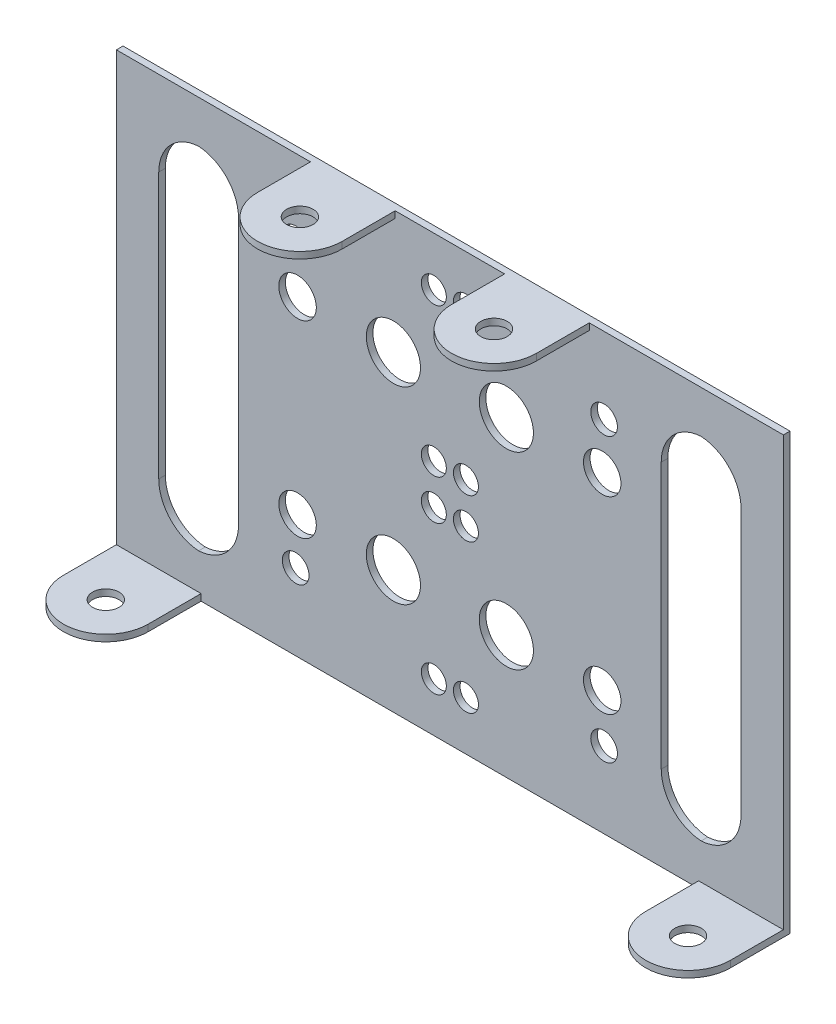
from build123d import *

# Parameters (mm, degrees)
SKETCH1_R             = 1.5875
BOSS_EXTRUDE1_DEPTH   = 1.5875
SKETCH1_W             = 12.7
SKETCH1_H             = 12.7
BOSS_EXTRUDE1_2_DEPTH = 1.5875
SKETCH2_W             = 69.85
SKETCH2_H             = 53
BOSS_EXTRUDE2_DEPTH   = 1.5875
BOSS_EXTRUDE3_DEPTH   = 1.5875
SKETCH6_W             = 1.5875
SKETCH6_H             = 53
BOSS_EXTRUDE4_DEPTH   = 12.7
SKETCH7_W             = 12.7
SKETCH7_H             = 12.7
CUT_EXTRUDE1_DEPTH    = 12.7
SKETCH10_W            = 13.49375
SKETCH10_H            = 0.79375
CUT_EXTRUDE3_DEPTH    = 100.134429722
SKETCH13_R            = 1.25
SKETCH13_R_2          = 3
SKETCH13_R_3          = 2.000000064
CUT_EXTRUDE4_DEPTH    = 12.7
FILLET1_R             = 6.35
FILLET2_R             = 6.35
SKETCH14_W            = 12.7
SKETCH14_H            = 12.7
SKETCH14_R            = 1.5875
BOSS_EXTRUDE5_DEPTH   = 0.79375
FILLET3_R             = 6.35
SKETCH15_R            = 1.6
CUT_EXTRUDE7_DEPTH    = 0.79375
SKETCH16_R            = 1.5875
BOSS_EXTRUDE6_DEPTH   = 0.79375
SKETCH17_W            = 12.7
SKETCH17_H            = 14.933466397
CUT_EXTRUDE8_DEPTH    = 0.79375
CUT_EXTRUDE9_DEPTH    = 0.79375
SKETCH19_W            = 1.27
SKETCH19_H            = 52.20625
CUT_EXTRUDE11_DEPTH   = 0.79375
CUT_EXTRUDE12_DEPTH   = 0.79375
FILLET4_R             = 5.08
FILLET5_R             = 5.08
SKETCH22_R            = 2.25
SKETCH22_R_2          = 2.000000064
SKETCH22_R_3          = 3.25
SKETCH22_R_4          = 3
SKETCH22_R_5          = 1.5
SKETCH22_R_6          = 1.25
CUT_EXTRUDE13_DEPTH   = 0.79375


# Some blends are built 0.0001 mm under size
with BuildPart() as part:
    # Sketch1 → Boss-Extrude1 (new body)
    with BuildSketch(Plane(origin=(0, 0, 0), x_dir=(1, 0, 0), z_dir=(0, 1, 0))):
        Polygon((-12.7, 0), (0, 0), (0, 12.7), (-12.7, 12.7), (-12.7, 6.35), align=None)
        with Locations(Location((-6.35, 6.35, 0), (0, 0, 270))):
            Circle(SKETCH1_R, mode=Mode.SUBTRACT)
    extrude(amount=BOSS_EXTRUDE1_DEPTH)



with BuildPart() as body_2:
    # Sketch1 → Boss-Extrude1 2 (new body)
    with BuildSketch(Plane(origin=(0, 0, 0), x_dir=(1, 0, 0), z_dir=(0, 1, 0))):
        with Locations((-63.5, 6.35)):
            Rectangle(SKETCH1_W, SKETCH1_H)
        with Locations(Location((-63.5, 6.35, 0), (0, 0, 270))):
            Circle(SKETCH1_R, mode=Mode.SUBTRACT)
    extrude(amount=BOSS_EXTRUDE1_2_DEPTH)


with BuildPart() as part_1:
    add(part.part)

    add(body_2.part)  # Boss-Extrude2 merges body 2
    # Sketch2 → Boss-Extrude2 (add)
    with BuildSketch(Plane(origin=(0, 0, -12.7), x_dir=(-1, 0, 0), z_dir=(0, 0, -1))):
        with Locations((34.925, 26.5)):
            Rectangle(SKETCH2_W, SKETCH2_H)
    extrude(amount=BOSS_EXTRUDE2_DEPTH)

    # Sketch5 → Boss-Extrude3 (add)
    with BuildSketch(Plane(origin=(0, 1.5875, 0), x_dir=(1, 0, 0), z_dir=(0, 1, 0))):
        with BuildLine():
            Line((-69.85, 0), (-69.85, 6.35))
            Line((-69.85, 6.35), (-74.6125, 6.35))
            ThreePointArc((-74.6125, 6.35), (-76.2, 4.7625), (-77.7875, 6.35))
            Line((-77.7875, 6.35), (-82.55, 6.35))
            Line((-82.55, 6.35), (-82.55, 0))
            Line((-82.55, 0), (-69.85, 0))
        make_face()
        with BuildLine():
            ThreePointArc((-77.7875, 6.35), (-77.322532015, 7.472532015), (-76.2, 7.9375))
            Line((-76.2, 7.9375), (-76.2, 12.7))
            Line((-76.2, 12.7), (-82.55, 12.7))
            Line((-82.55, 12.7), (-82.55, 6.35))
            Line((-82.55, 6.35), (-77.7875, 6.35))
        make_face()
        with BuildLine():
            Line((-74.6125, 6.35), (-69.85, 6.35))
            Line((-69.85, 6.35), (-69.85, 12.7))
            Line((-69.85, 12.7), (-76.2, 12.7))
            Line((-76.2, 12.7), (-76.2, 7.9375))
            ThreePointArc((-76.2, 7.9375), (-75.077467985, 7.472532015), (-74.6125, 6.35))
        make_face()
    extrude(amount=-BOSS_EXTRUDE3_DEPTH)

    # Sketch6 → Boss-Extrude4 (add)
    with BuildSketch(Plane.ZY.offset(69.85)):
        with Locations((-13.49375, 26.5)):
            Rectangle(SKETCH6_W, SKETCH6_H)
    extrude(amount=BOSS_EXTRUDE4_DEPTH)

    # Sketch7 → Cut-Extrude1 (cut)
    with BuildSketch(Plane(origin=(0, 1.5875, 0), x_dir=(1, 0, 0), z_dir=(0, 1, 0))):
        with Locations((-63.5, 6.35)):
            Rectangle(SKETCH7_W, SKETCH7_H)
    extrude(amount=-CUT_EXTRUDE1_DEPTH, mode=Mode.SUBTRACT)

    # Sketch10 → Cut-Extrude3 (cut, through all)
    with BuildSketch(Plane(origin=(0, 0, 0), x_dir=(0, 0, -1), z_dir=(1, 0, 0))):
        with Locations((6.746875, 0.396875)):
            Rectangle(SKETCH10_W, SKETCH10_H)
        Polygon((13.49375, 0.79375), (13.49375, 0), (14.2875, 0), (14.2875, 53), (13.49375, 53), align=None)
    extrude(amount=-CUT_EXTRUDE3_DEPTH, mode=Mode.SUBTRACT)

    # Sketch13 → Cut-Extrude4 (cut)
    with BuildSketch(Plane(origin=(0, 0, -13.49375), x_dir=(-1, 0, 0), z_dir=(0, 0, -1))):
        with Locations((43.2, 24.48749994)):
            Circle(SKETCH13_R)
        with Locations((43.2, 6.68749994)):
            Circle(SKETCH13_R)
        with Locations((34.5, 15.58749994)):
            Circle(SKETCH13_R_2)
        with Locations((23, 15.58749994)):
            Circle(SKETCH13_R_3)
        with Locations((39.35, 6.68749994)):
            Circle(SKETCH13_R)
        with Locations((39.35, 24.48749994)):
            Circle(SKETCH13_R)
        with Locations((48.05, 15.58749994)):
            Circle(SKETCH13_R_2)
        with Locations((59.55, 15.58749994)):
            Circle(SKETCH13_R_3)
        with Locations((59.55, 38.20625006)):
            Circle(SKETCH13_R_3)
        with Locations((48.05, 38.20625006)):
            Circle(SKETCH13_R_2)
        with Locations((39.35, 29.30625006)):
            Circle(SKETCH13_R)
        with Locations(Location((39.35, 47.10625006, 0), (0, 0, 180))):
            Circle(SKETCH13_R)
        with Locations((23, 38.20625006)):
            Circle(SKETCH13_R_3)
        with Locations((34.5, 38.20625006)):
            Circle(SKETCH13_R_2)
        with Locations((43.2, 47.10625006)):
            Circle(SKETCH13_R)
        with Locations((43.2, 29.30625006)):
            Circle(SKETCH13_R)
    extrude(amount=-CUT_EXTRUDE4_DEPTH, mode=Mode.SUBTRACT)

    # Fillet1
    fillet1_edges = [part_1.edges().sort_by_distance(p)[0] for p in [
        (-12.7, 1.190625, 0),
        (0, 1.190625, 0),
    ]]
    fillet(fillet1_edges, radius=FILLET1_R - 0.0001)  # a hair under: the kernel refuses the full size

    # Fillet2
    fillet2_edges = [part_1.edges().sort_by_distance(p)[0] for p in [
        (-82.55, 1.190625, 0),
        (-69.85, 1.190625, 0),
    ]]
    fillet(fillet2_edges, radius=FILLET2_R - 0.0001)  # a hair under: the kernel refuses the full size

    # Sketch14 → Boss-Extrude5 (add)
    with BuildSketch(Plane(origin=(0, 53, 0), x_dir=(1, 0, 0), z_dir=(0, 1, 0))):
        with Locations((-41.275, 6.35)):
            Rectangle(SKETCH14_W, SKETCH14_H)
        with Locations(Location((-41.275, 6.35, 0), (0, 0, 270))):
            Circle(SKETCH14_R, mode=Mode.SUBTRACT)
    extrude(amount=-BOSS_EXTRUDE5_DEPTH)

    # Fillet3
    fillet3_edges = [part_1.edges().sort_by_distance(p)[0] for p in [
        (-47.625, 52.603125, 0),
        (-34.925, 52.603125, 0),
    ]]
    fillet(fillet3_edges, radius=FILLET3_R - 0.0001)  # a hair under: the kernel refuses the full size

    # Sketch15 → Cut-Extrude7 (cut)
    with BuildSketch(Plane(origin=(0, 0, -13.49375), x_dir=(-1, 0, 0), z_dir=(0, 0, -1))):
        with Locations((22.775, 43.862031033)):
            Circle(SKETCH15_R)
        with Locations((22.775, 9.931718967)):
            Circle(SKETCH15_R)
        with Locations((59.775, 9.931718967)):
            Circle(SKETCH15_R)
        with Locations((59.775, 43.862031033)):
            Circle(SKETCH15_R)
    extrude(amount=-CUT_EXTRUDE7_DEPTH, mode=Mode.SUBTRACT)

    # Sketch16 → Boss-Extrude6 (add)
    # profile 1 of 2: a face of its own
    with BuildSketch(Plane(origin=(0, 53, 0), x_dir=(1, 0, 0), z_dir=(0, 1, 0))):
        with BuildLine():
            Line((-57.996666667, 12.7), (-57.996666667, 6.35))
            ThreePointArc((-57.996666667, 6.35), (-52.916666667, 1.27), (-47.836666667, 6.35))
            Line((-47.836666667, 6.35), (-47.836666667, 12.7))
            Line((-47.836666667, 12.7), (-57.996666667, 12.7))
        make_face()
        with Locations(Location((-52.916666667, 6.35, 0), (0, 0, 270))):
            Circle(SKETCH16_R, mode=Mode.SUBTRACT)
    # profile 2 of 2: a face of its own
    with BuildSketch(Plane(origin=(0, 53, 0), x_dir=(1, 0, 0), z_dir=(0, 1, 0))):
        with BuildLine():
            Line((-24.553333333, 12.7), (-34.713333333, 12.7))
            Line((-34.713333333, 12.7), (-34.713333333, 6.35))
            ThreePointArc((-34.713333333, 6.35), (-29.633333333, 1.27), (-24.553333333, 6.35))
            Line((-24.553333333, 6.35), (-24.553333333, 12.7))
        make_face()
        with Locations(Location((-29.633333333, 6.35, 0), (0, 0, 270))):
            Circle(SKETCH16_R, mode=Mode.SUBTRACT)
    extrude(amount=-BOSS_EXTRUDE6_DEPTH)

    # Sketch17 → Cut-Extrude8 (cut)
    with BuildSketch(Plane(origin=(0, 53, 0), x_dir=(1, 0, 0), z_dir=(0, 1, 0))):
        with Locations((-41.275, 5.233266802)):
            Rectangle(SKETCH17_W, SKETCH17_H)
    extrude(amount=-CUT_EXTRUDE8_DEPTH, mode=Mode.SUBTRACT)

    # Sketch18 → Cut-Extrude9 (cut)
    with BuildSketch(Plane(origin=(0, 1.5875, 0), x_dir=(1, 0, 0), z_dir=(0, 1, 0))):
        with BuildLine():
            ThreePointArc((-71.12, 6.35), (-76.2, 1.27), (-81.28, 6.35))
            Line((-81.28, 6.35), (-81.28, 12.7))
            Line((-81.28, 12.7), (-82.55, 12.7))
            Line((-82.55, 12.7), (-82.55, 6.35))
            ThreePointArc((-82.55, 6.35), (-80.690128061, 1.859871939), (-76.2, 0))
            ThreePointArc((-76.2, 0), (-71.709871939, 1.859871939), (-69.85, 6.35))
            Line((-69.85, 6.35), (-69.85, 12.7))
            Line((-69.85, 12.7), (-71.12, 12.7))
            Line((-71.12, 12.7), (-71.12, 6.35))
        make_face()
        with BuildLine():
            Line((-1.27, 6.35), (-1.27, 12.7))
            Line((-1.27, 12.7), (0, 12.7))
            Line((0, 12.7), (0, 6.35))
            ThreePointArc((0, 6.35), (-6.35, 0), (-12.7, 6.35))
            Line((-12.7, 6.35), (-12.7, 12.7))
            Line((-12.7, 12.7), (-11.43, 12.7))
            Line((-11.43, 12.7), (-11.43, 6.35))
            ThreePointArc((-11.43, 6.35), (-6.35, 1.27), (-1.27, 6.35))
        make_face()
    extrude(amount=-CUT_EXTRUDE9_DEPTH, mode=Mode.SUBTRACT)


with BuildPart() as cut_extrude9_kept_piece:
    # of the separate pieces the step leaves, the one the design keeps (cut_extrude9_pieces_kept)
    add(part_1.part.solids().sort_by_distance((-34.713333333, 53, -12.7))[0])

    # Sketch19 → Cut-Extrude11 (cut)
    with BuildSketch(Plane.XY.offset(-12.7)):
        Polygon((-82.55, 53), (-82.55, 0.79375), (-81.28, 0.79375), (-81.28, 1.5875), (-81.28, 53), align=None)
        with Locations((-0.635, 26.896875)):
            Rectangle(SKETCH19_W, SKETCH19_H)
    extrude(amount=-CUT_EXTRUDE11_DEPTH, mode=Mode.SUBTRACT)

    # Sketch21 → Cut-Extrude12 (cut)
    with BuildSketch(Plane.XY.offset(-12.7)):
        Polygon((-76.2, 5.87375), (-66.630000064, 5.87375), (-66.630000064, 47.92), (-76.2, 47.92), (-76.2, 26.93749994), align=None)
        Polygon((-15.919999936, 47.92), (-6.35, 47.92), (-6.35, 26.93749994), (-6.35, 5.87375), (-15.919999936, 5.87375), align=None)
    extrude(amount=-CUT_EXTRUDE12_DEPTH, mode=Mode.SUBTRACT)

    # Fillet4
    # the kernel refuses this fillet: 5.08 mm, written as the material it adds along each edge
    with BuildSketch(Plane(origin=(-76.2, 47.92, -12.7), x_dir=(0, -1, 0), z_dir=(0, 0, -1)), Plane(origin=(-66.630000064, 47.92, -12.7), x_dir=(-1, 0, 0), z_dir=(0, 0, -1))) as fillet4_piece_1:
        with BuildLine():
            CenterArc((FILLET4_R, -FILLET4_R), FILLET4_R, 90, 90)
            Line((0, -FILLET4_R), (0, 0))
            Line((0, 0), (FILLET4_R, 0))
        make_face()
    extrude(amount=0.79375)

    # Fillet5
    # the kernel refuses this fillet: 5.08 mm, written as the material it adds along each edge
    with BuildSketch(Plane(origin=(-6.35, 47.92, -12.7), x_dir=(-1, 0, 0), z_dir=(0, 0, -1)), Plane(origin=(-15.919999936, 5.87375, -12.7), x_dir=(1, 0, 0), z_dir=(0, 0, -1)), Plane(origin=(-6.35, 5.87375, -12.7), x_dir=(0, 1, 0), z_dir=(0, 0, -1)), Plane(origin=(-66.630000064, 5.87375, -12.7), x_dir=(0, 1, 0), z_dir=(0, 0, -1))) as fillet5_piece_1:
        with BuildLine():
            CenterArc((FILLET5_R, -FILLET5_R), FILLET5_R, 90, 90)
            Line((0, -FILLET5_R), (0, 0))
            Line((0, 0), (FILLET5_R, 0))
        make_face()
    extrude(amount=0.79375)
    with BuildSketch(Plane(origin=(-15.919999936, 47.92, -12.7), x_dir=(1, 0, 0), z_dir=(0, 0, -1)), Plane(origin=(-76.2, 5.87375, -12.7), x_dir=(0, 1, 0), z_dir=(0, 0, -1))) as fillet5_piece_2:
        with BuildLine():
            CenterArc((FILLET5_R, FILLET5_R), FILLET5_R, 180, 90)
            Line((0, FILLET5_R), (0, 0))
            Line((0, 0), (FILLET5_R, 0))
        make_face()
    extrude(amount=0.79375)

    # Sketch22 → Cut-Extrude13 (cut)
    # profile 1 of 16: a face of its own
    with BuildSketch(Plane(origin=(0, 0, -13.49375), x_dir=(-1, 0, 0), z_dir=(0, 0, -1))):
        with Locations((23, 38.20625006)):
            Circle(SKETCH22_R)
        with Locations((23, 38.20625006)):
            Circle(SKETCH22_R_2, mode=Mode.SUBTRACT)
    # profile 2 of 16: a face of its own
    with BuildSketch(Plane(origin=(0, 0, -13.49375), x_dir=(-1, 0, 0), z_dir=(0, 0, -1))):
        with Locations((34.5, 38.20625006)):
            Circle(SKETCH22_R_3)
        with Locations((34.5, 38.20625006)):
            Circle(SKETCH22_R_4, mode=Mode.SUBTRACT)
    # profile 3 of 16: a face of its own
    with BuildSketch(Plane(origin=(0, 0, -13.49375), x_dir=(-1, 0, 0), z_dir=(0, 0, -1))):
        with Locations((39.35, 47.10625006)):
            Circle(SKETCH22_R_5)
        with Locations((39.35, 47.10625006)):
            Circle(SKETCH22_R_6, mode=Mode.SUBTRACT)
    # profile 4 of 16: a face of its own
    with BuildSketch(Plane(origin=(0, 0, -13.49375), x_dir=(-1, 0, 0), z_dir=(0, 0, -1))):
        with Locations((43.2, 47.10625006)):
            Circle(SKETCH22_R_5)
        with Locations((43.2, 47.10625006)):
            Circle(SKETCH22_R_6, mode=Mode.SUBTRACT)
    # profile 5 of 16: a face of its own
    with BuildSketch(Plane(origin=(0, 0, -13.49375), x_dir=(-1, 0, 0), z_dir=(0, 0, -1))):
        with Locations((48.05, 38.20625006)):
            Circle(SKETCH22_R_3)
        with Locations((48.05, 38.20625006)):
            Circle(SKETCH22_R_4, mode=Mode.SUBTRACT)
    # profile 6 of 16: a face of its own
    with BuildSketch(Plane(origin=(0, 0, -13.49375), x_dir=(-1, 0, 0), z_dir=(0, 0, -1))):
        with Locations((59.55, 38.20625006)):
            Circle(SKETCH22_R)
        with Locations((59.55, 38.20625006)):
            Circle(SKETCH22_R_2, mode=Mode.SUBTRACT)
    # profile 7 of 16: a face of its own
    with BuildSketch(Plane(origin=(0, 0, -13.49375), x_dir=(-1, 0, 0), z_dir=(0, 0, -1))):
        with Locations((59.55, 15.58749994)):
            Circle(SKETCH22_R)
        with Locations((59.55, 15.58749994)):
            Circle(SKETCH22_R_2, mode=Mode.SUBTRACT)
    # profile 8 of 16: a face of its own
    with BuildSketch(Plane(origin=(0, 0, -13.49375), x_dir=(-1, 0, 0), z_dir=(0, 0, -1))):
        with Locations((39.35, 6.68749994)):
            Circle(SKETCH22_R_5)
        with Locations((39.35, 6.68749994)):
            Circle(SKETCH22_R_6, mode=Mode.SUBTRACT)
    # profile 9 of 16: a face of its own
    with BuildSketch(Plane(origin=(0, 0, -13.49375), x_dir=(-1, 0, 0), z_dir=(0, 0, -1))):
        with Locations((43.2, 6.68749994)):
            Circle(SKETCH22_R_5)
        with Locations((43.2, 6.68749994)):
            Circle(SKETCH22_R_6, mode=Mode.SUBTRACT)
    # profile 10 of 16: a face of its own
    with BuildSketch(Plane(origin=(0, 0, -13.49375), x_dir=(-1, 0, 0), z_dir=(0, 0, -1))):
        with Locations((34.5, 15.58749994)):
            Circle(SKETCH22_R_3)
        with Locations((34.5, 15.58749994)):
            Circle(SKETCH22_R_4, mode=Mode.SUBTRACT)
    # profile 11 of 16: a face of its own
    with BuildSketch(Plane(origin=(0, 0, -13.49375), x_dir=(-1, 0, 0), z_dir=(0, 0, -1))):
        with Locations((48.05, 15.58749994)):
            Circle(SKETCH22_R_3)
        with Locations((48.05, 15.58749994)):
            Circle(SKETCH22_R_4, mode=Mode.SUBTRACT)
    # profile 12 of 16: a face of its own
    with BuildSketch(Plane(origin=(0, 0, -13.49375), x_dir=(-1, 0, 0), z_dir=(0, 0, -1))):
        with Locations((39.35, 24.48749994)):
            Circle(SKETCH22_R_5)
        with Locations((39.35, 24.48749994)):
            Circle(SKETCH22_R_6, mode=Mode.SUBTRACT)
    # profile 13 of 16: a face of its own
    with BuildSketch(Plane(origin=(0, 0, -13.49375), x_dir=(-1, 0, 0), z_dir=(0, 0, -1))):
        with Locations((43.2, 24.48749994)):
            Circle(SKETCH22_R_5)
        with Locations((43.2, 24.48749994)):
            Circle(SKETCH22_R_6, mode=Mode.SUBTRACT)
    # profile 14 of 16: a face of its own
    with BuildSketch(Plane(origin=(0, 0, -13.49375), x_dir=(-1, 0, 0), z_dir=(0, 0, -1))):
        with Locations((43.2, 29.30625006)):
            Circle(SKETCH22_R_5)
        with Locations((43.2, 29.30625006)):
            Circle(SKETCH22_R_6, mode=Mode.SUBTRACT)
    # profile 15 of 16: a face of its own
    with BuildSketch(Plane(origin=(0, 0, -13.49375), x_dir=(-1, 0, 0), z_dir=(0, 0, -1))):
        with Locations((39.35, 29.30625006)):
            Circle(SKETCH22_R_5)
        with Locations((39.35, 29.30625006)):
            Circle(SKETCH22_R_6, mode=Mode.SUBTRACT)
    # profile 16 of 16: a face of its own
    with BuildSketch(Plane(origin=(0, 0, -13.49375), x_dir=(-1, 0, 0), z_dir=(0, 0, -1))):
        with Locations((23, 15.58749994)):
            Circle(SKETCH22_R)
        with Locations((23, 15.58749994)):
            Circle(SKETCH22_R_2, mode=Mode.SUBTRACT)
    extrude(amount=-CUT_EXTRUDE13_DEPTH, mode=Mode.SUBTRACT)


solid = cut_extrude9_kept_piece.part
